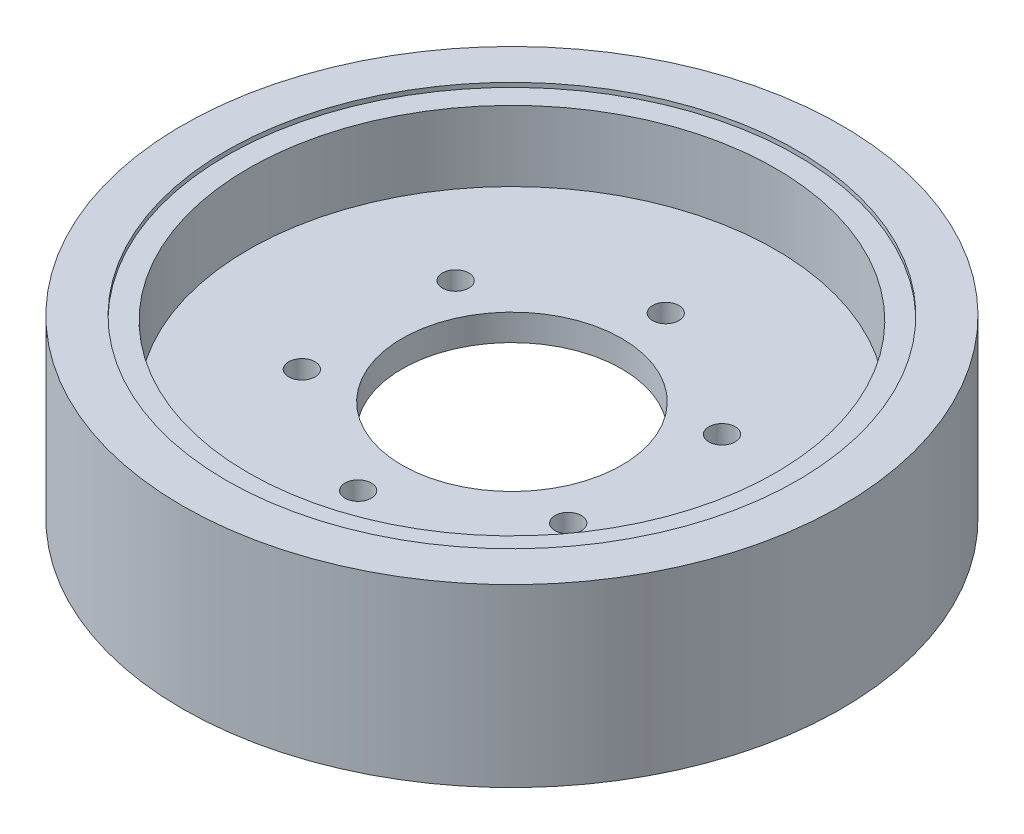
from build123d import *

# Parameters (mm, degrees)
SKETCH1_R           = 75
BOSS_EXTRUDE1_DEPTH = 40
SKETCH2_R           = 60
CUT_EXTRUDE1_DEPTH  = 17
SKETCH3_R           = 25
CUT_EXTRUDE2_DEPTH  = 109.531101533
SKETCH4_R           = 3
CUT_EXTRUDE3_DEPTH  = 109.531101533
CUT_EXTRUDE4_START  = -17
SKETCH6_R           = 60
CUT_EXTRUDE4_DEPTH  = 17
SKETCH7_R           = 65
CUT_EXTRUDE5_DEPTH  = 1
CUT_EXTRUDE6_START  = -1
SKETCH8_R           = 65
CUT_EXTRUDE6_DEPTH  = 1


with BuildPart() as part:
    # Sketch1 → Boss-Extrude1 (new body)
    with BuildSketch(Plane(origin=(0, 0, 0), x_dir=(1, 0, 0), z_dir=(0, 1, 0))):
        Circle(SKETCH1_R)
    extrude(amount=BOSS_EXTRUDE1_DEPTH)

    # Sketch2 → Cut-Extrude1 (cut)
    with BuildSketch(Plane(origin=(0, 40, 0), x_dir=(1, 0, 0), z_dir=(0, 1, 0))):
        Circle(SKETCH2_R)
    extrude(amount=-CUT_EXTRUDE1_DEPTH, mode=Mode.SUBTRACT)

    # Sketch3 → Cut-Extrude2 (cut, through all)
    with BuildSketch(Plane(origin=(0, 23, 0), x_dir=(1, 0, 0), z_dir=(0, 1, 0))):
        Circle(SKETCH3_R)
    extrude(amount=-CUT_EXTRUDE2_DEPTH, mode=Mode.SUBTRACT)

    # Sketch4 → Cut-Extrude3 (cut, through all)
    with BuildSketch(Plane(origin=(0, 23, 0), x_dir=(1, 0, 0), z_dir=(0, 1, 0))):
        with Locations((0, 35)):
            Circle(SKETCH4_R)
        with Locations((30.310889132, 17.5)):
            Circle(SKETCH4_R)
        with Locations((30.310889132, -17.5)):
            Circle(SKETCH4_R)
        with Locations((0, -35)):
            Circle(SKETCH4_R)
        with Locations((-30.310889132, -17.5)):
            Circle(SKETCH4_R)
        with Locations((-30.310889132, 17.5)):
            Circle(SKETCH4_R)
    extrude(amount=-CUT_EXTRUDE3_DEPTH, mode=Mode.SUBTRACT)

    # Sketch6 → Cut-Extrude4 (cut)
    with BuildSketch(Plane.XZ.offset(CUT_EXTRUDE4_START)):
        Circle(SKETCH6_R)
    extrude(amount=CUT_EXTRUDE4_DEPTH, mode=Mode.SUBTRACT)

    # Sketch7 → Cut-Extrude5 (cut)
    with BuildSketch(Plane.XZ):
        Circle(SKETCH7_R)
    extrude(amount=-CUT_EXTRUDE5_DEPTH, mode=Mode.SUBTRACT)

    # Sketch8 → Cut-Extrude6 (cut)
    with BuildSketch(Plane(origin=(0, 40, 0), x_dir=(1, 0, 0), z_dir=(0, 1, 0)).offset(CUT_EXTRUDE6_START)):
        Circle(SKETCH8_R)
    extrude(amount=CUT_EXTRUDE6_DEPTH, mode=Mode.SUBTRACT)


solid = part.part
